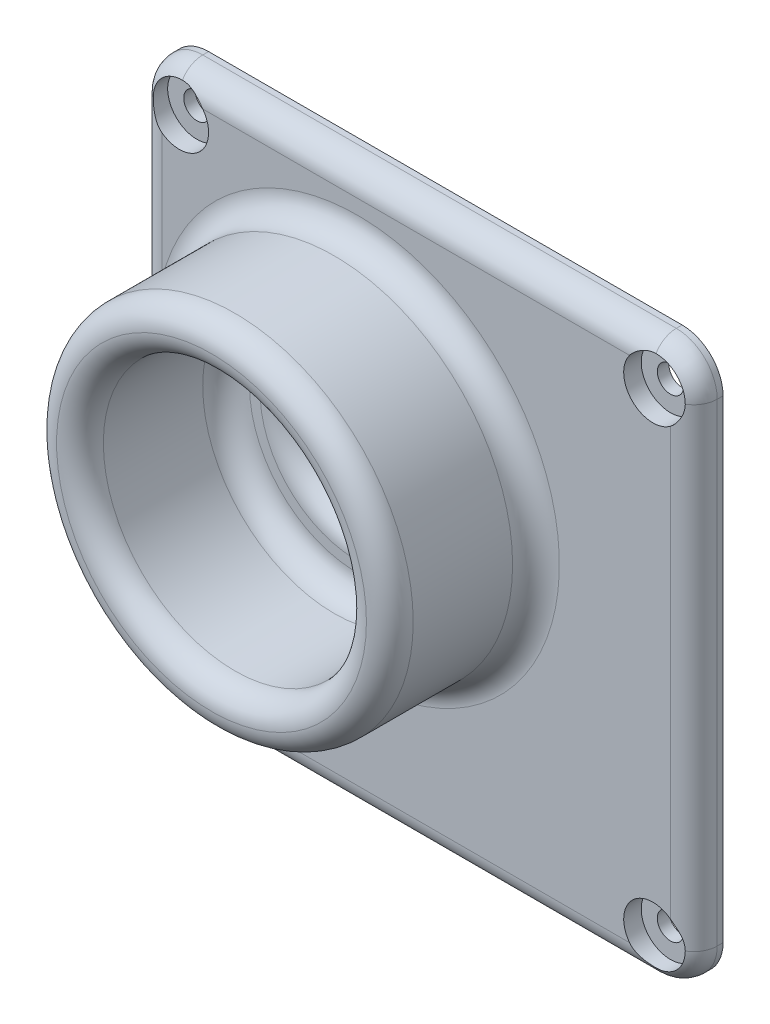
from build123d import *

# Parameters (mm, degrees)
SKETCH2_W           = 95
SKETCH2_H           = 95
SKETCH2_R           = 2.25
BOSS_EXTRUDE1_DEPTH = 5
FILLET1_R           = 7
FILLET2_R           = 4
SKETCH3_R           = 5
CUT_EXTRUDE1_DEPTH  = 3
SKETCH4_R           = 12.7
CUT_EXTRUDE2_DEPTH  = 68.360968068
FILLET3_R           = 4
SKETCH5_R           = 30.5
SKETCH5_R_2         = 22.5
BOSS_EXTRUDE2_DEPTH = 25
FILLET4_R           = 4


with BuildPart() as part:
    # Sketch2 → Boss-Extrude1 (new body)
    with BuildSketch(Plane(origin=(0, 0, 0), x_dir=(0, 1, 0), z_dir=(0, 0, 1))):
        Rectangle(SKETCH2_W, SKETCH2_H)
        with Locations(Location((40.5, 40.5, 0), (0, 0, 270))):
            Circle(SKETCH2_R, mode=Mode.SUBTRACT)
        with Locations(Location((-40.5, 40.5, 0), (0, 0, 270))):
            Circle(SKETCH2_R, mode=Mode.SUBTRACT)
        with Locations(Location((-40.5, -40.5, 0), (0, 0, 270))):
            Circle(SKETCH2_R, mode=Mode.SUBTRACT)
        with Locations(Location((40.5, -40.5, 0), (0, 0, 270))):
            Circle(SKETCH2_R, mode=Mode.SUBTRACT)
    extrude(amount=BOSS_EXTRUDE1_DEPTH)

    # Fillet1
    fillet1_edges = [part.edges().sort_by_distance(p)[0] for p in [
        (-47.5, -47.5, 2.5),
        (-47.5, 47.5, 2.5),
        (47.5, 47.5, 2.5),
        (47.5, -47.5, 2.5),
    ]]
    fillet(fillet1_edges, radius=FILLET1_R)

    # Fillet2
    fillet2_edges = [part.edges().sort_by_distance(p)[0] for p in [
        (0, 47.5, 5),
        (47.5, 0, 5),
        (0, -47.5, 5),
        (-47.5, 0, 5),
        (-45.449747468, 45.449747468, 5),
        (-45.449747468, -45.449747468, 5),
        (45.449747468, -45.449747468, 5),
        (45.449747468, 45.449747468, 5),
    ]]
    fillet(fillet2_edges, radius=FILLET2_R)

    # Sketch3 → Cut-Extrude1 (cut)
    with BuildSketch(Plane.XY.offset(5)):
        with Locations((-40.5, -40.5)):
            Circle(SKETCH3_R)
        with Locations((-40.5, 40.5)):
            Circle(SKETCH3_R)
        with Locations((40.5, 40.5)):
            Circle(SKETCH3_R)
        with Locations((40.5, -40.5)):
            Circle(SKETCH3_R)
    extrude(amount=-CUT_EXTRUDE1_DEPTH, mode=Mode.SUBTRACT)

    # Sketch4 → Cut-Extrude2 (cut, through all)
    with BuildSketch(Plane.XY.offset(5)):
        with Locations((-10, 6.5)):
            Circle(SKETCH4_R)
    extrude(amount=-CUT_EXTRUDE2_DEPTH, mode=Mode.SUBTRACT)

    # Fillet3
    fillet3_edges = [part.edges().sort_by_distance(p)[0] for p in [
        (-22.7, 6.5, 5),
    ]]
    fillet(fillet3_edges, radius=FILLET3_R)

    # Sketch5 → Boss-Extrude2 (add)
    with BuildSketch(Plane.XY.offset(5)):
        with Locations((-10, 6.5)):
            Circle(SKETCH5_R)
        with Locations((-10, 6.5)):
            Circle(SKETCH5_R_2, mode=Mode.SUBTRACT)
    extrude(amount=BOSS_EXTRUDE2_DEPTH)

    # Fillet4
    fillet4_edges = [part.edges().sort_by_distance(p)[0] for p in [
        (-32.5, 6.5, 5),
        (-40.5, 6.5, 30),
        (-40.5, 6.5, 5),
        (-32.5, 6.5, 30),
    ]]
    fillet(fillet4_edges, radius=FILLET4_R - 0.0001)  # a hair under: the kernel refuses the full size


solid = part.part
